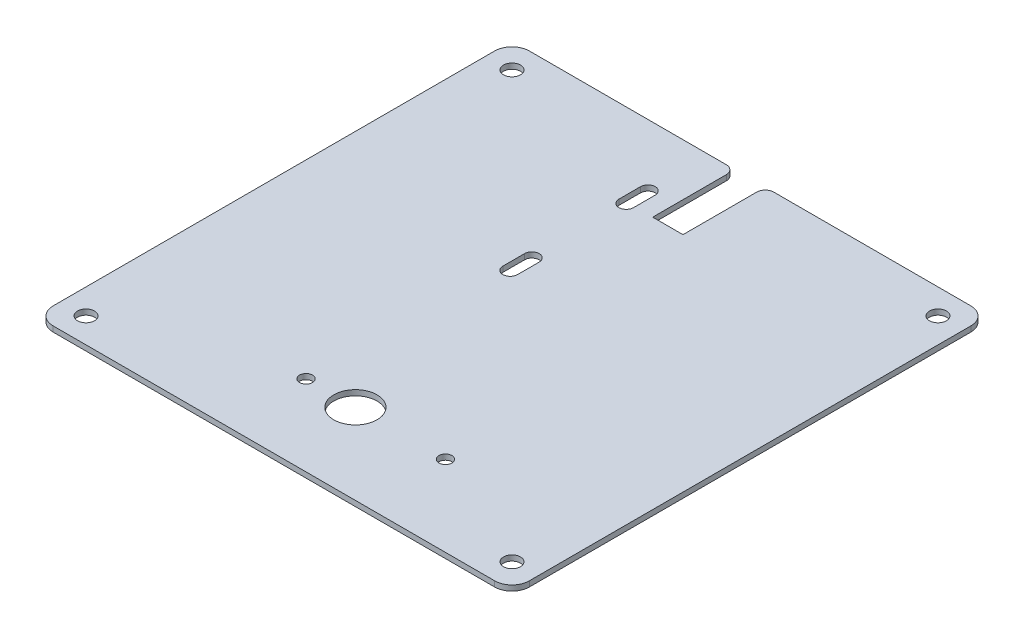
from build123d import *

# Parameters (mm, degrees)
SKETCH1_R           = 2.4892
SKETCH1_R_2         = 6.35
SKETCH1_R_3         = 1.905
BOSS_EXTRUDE1_DEPTH = 1.5875


with BuildPart() as part:
    # Sketch1 → Boss-Extrude1 (new body)
    with BuildSketch(Plane(origin=(0, 0, 0), x_dir=(1, 0, 0), z_dir=(0, 1, 0))):
        with BuildLine():
            Line((61.029963168, -65.365948435), (61.029963168, 64.174051565))
            ThreePointArc((61.029963168, 64.174051565), (59.542065616, 67.766154014), (55.949963168, 69.254051565))
            Line((55.949963168, 69.254051565), (-1.835036832, 69.254051565))
            ThreePointArc((-1.835036832, 69.254051565), (-3.631088057, 68.51010279), (-4.375036832, 66.714051565))
            Line((-4.375036832, 66.714051565), (-4.375036832, 45.124051565))
            Line((-4.375036832, 45.124051565), (-13.265036832, 45.124051565))
            Line((-13.265036832, 45.124051565), (-13.265036832, 66.714051565))
            ThreePointArc((-13.265036832, 66.714051565), (-14.008985608, 68.51010279), (-15.805036832, 69.254051565))
            Line((-15.805036832, 69.254051565), (-73.590036832, 69.254051565))
            ThreePointArc((-73.590036832, 69.254051565), (-77.182139281, 67.766154014), (-78.670036832, 64.174051565))
            Line((-78.670036832, 64.174051565), (-78.670036832, -65.365948435))
            ThreePointArc((-78.670036832, -65.365948435), (-77.182139281, -68.958050883), (-73.590036832, -70.445948435))
            Line((-73.590036832, -70.445948435), (55.949963168, -70.445948435))
            ThreePointArc((55.949963168, -70.445948435), (59.542065616, -68.958050883), (61.029963168, -65.365948435))
        make_face()
        with Locations((53.663963168, -63.079948435)):
            Circle(SKETCH1_R, mode=Mode.SUBTRACT)
        with Locations((-71.304036832, 61.888051565)):
            Circle(SKETCH1_R, mode=Mode.SUBTRACT)
        with Locations((53.663963168, 61.888051565)):
            Circle(SKETCH1_R, mode=Mode.SUBTRACT)
        with Locations((-71.304036832, -63.079948435)):
            Circle(SKETCH1_R, mode=Mode.SUBTRACT)
        with Locations((-8.566036832, -46.794093712)):
            Circle(SKETCH1_R_2, mode=Mode.SUBTRACT)
        with Locations((17.849963168, -46.794093712)):
            Circle(SKETCH1_R_3, mode=Mode.SUBTRACT)
        with Locations((-23.044036832, -46.794093712)):
            Circle(SKETCH1_R_3, mode=Mode.SUBTRACT)
        with BuildLine():
            Line((-18.495036832, 44.748051566), (-18.495036832, 51.098051566))
            ThreePointArc((-18.495036832, 51.098051566), (-20.647686832, 53.250701566), (-22.800336832, 51.098051566))
            Line((-22.800336832, 51.098051566), (-22.800336832, 44.748051566))
            ThreePointArc((-22.800336832, 44.748051566), (-20.647686832, 42.595401566), (-18.495036832, 44.748051566))
        make_face(mode=Mode.SUBTRACT)
        with BuildLine():
            Line((-22.800336832, 10.712051566), (-22.800336832, 17.062051566))
            ThreePointArc((-22.800336832, 17.062051566), (-20.647686832, 19.214701566), (-18.495036832, 17.062051566))
            Line((-18.495036832, 17.062051566), (-18.495036832, 10.712051566))
            ThreePointArc((-18.495036832, 10.712051566), (-20.647686832, 8.559401566), (-22.800336832, 10.712051566))
        make_face(mode=Mode.SUBTRACT)
    extrude(amount=BOSS_EXTRUDE1_DEPTH)


solid = part.part
